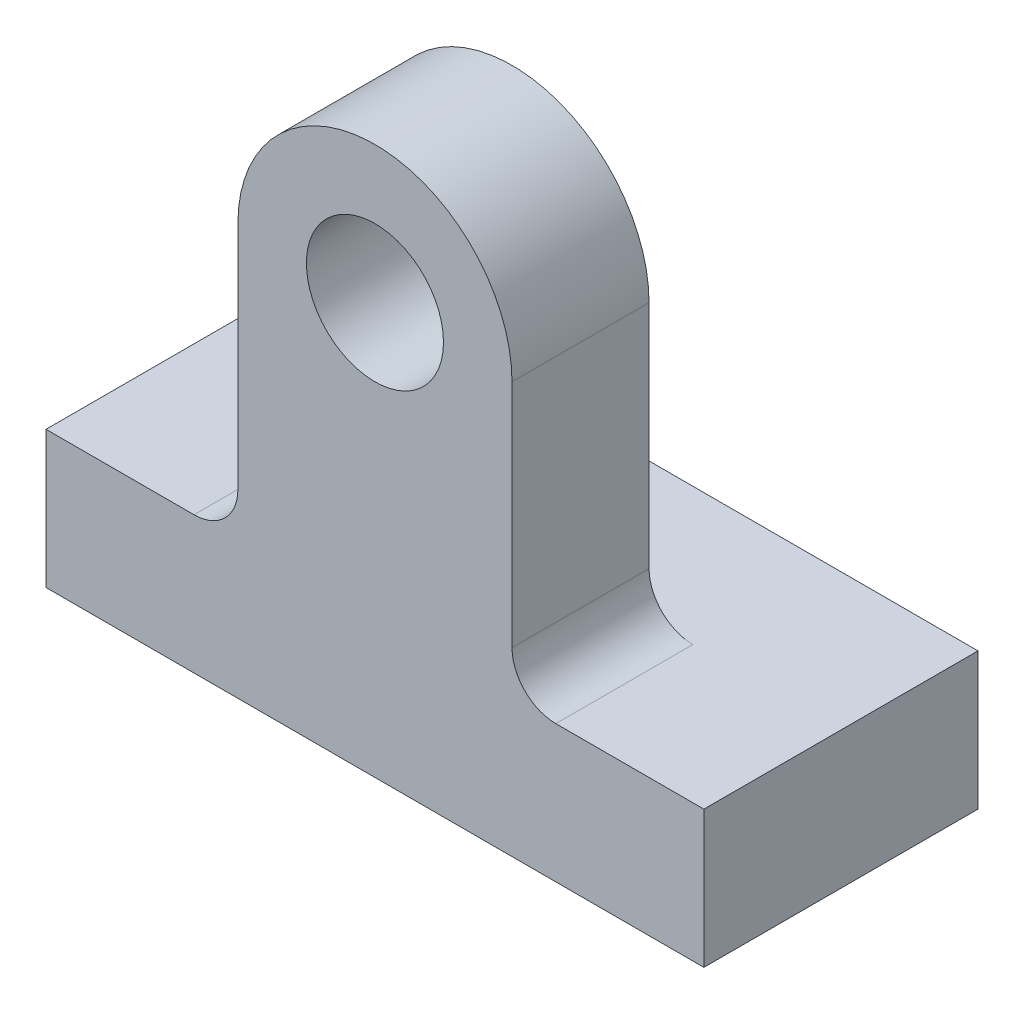
from build123d import *

# Parameters (mm, degrees)
RECTANGLE_SKETCH_W           = 3048
RECTANGLE_SKETCH_H           = 1270
RECTANGLEEXTRUDE_DEPTH       = 635
CURVEDRECTANGLESKETCH_R      = 317.5
CURVEDRECTANGLEEXTRUDE_DEPTH = 635
CURVEDRECTANGLEFILLET_R      = 203.2


with BuildPart() as part:
    # Rectangle Sketch → RectangleExtrude (new body)
    with BuildSketch(Plane(origin=(0, 0, 0), x_dir=(1, 0, 0), z_dir=(0, 1, 0))):
        with Locations((1524, -635)):
            Rectangle(RECTANGLE_SKETCH_W, RECTANGLE_SKETCH_H)
    extrude(amount=RECTANGLEEXTRUDE_DEPTH)

    # CurvedRectangleSketch → CurvedRectangleExtrude (add)
    with BuildSketch(Plane.XY.offset(1270)):
        with BuildLine():
            Line((889, 635), (889, 1905))
            ThreePointArc((889, 1905), (1524, 2540), (2159, 1905))
            Line((2159, 1905), (2159, 635))
            Line((2159, 635), (889, 635))
        make_face()
        with Locations((1524, 1905)):
            Circle(CURVEDRECTANGLESKETCH_R, mode=Mode.SUBTRACT)
    extrude(amount=-CURVEDRECTANGLEEXTRUDE_DEPTH)

    # CurvedRectangleFillet
    curvedrectanglefillet_edges = [part.edges().sort_by_distance(p)[0] for p in [
        (2159, 635, 952.5),
        (889, 635, 952.5),
    ]]
    fillet(curvedrectanglefillet_edges, radius=CURVEDRECTANGLEFILLET_R)


solid = part.part
